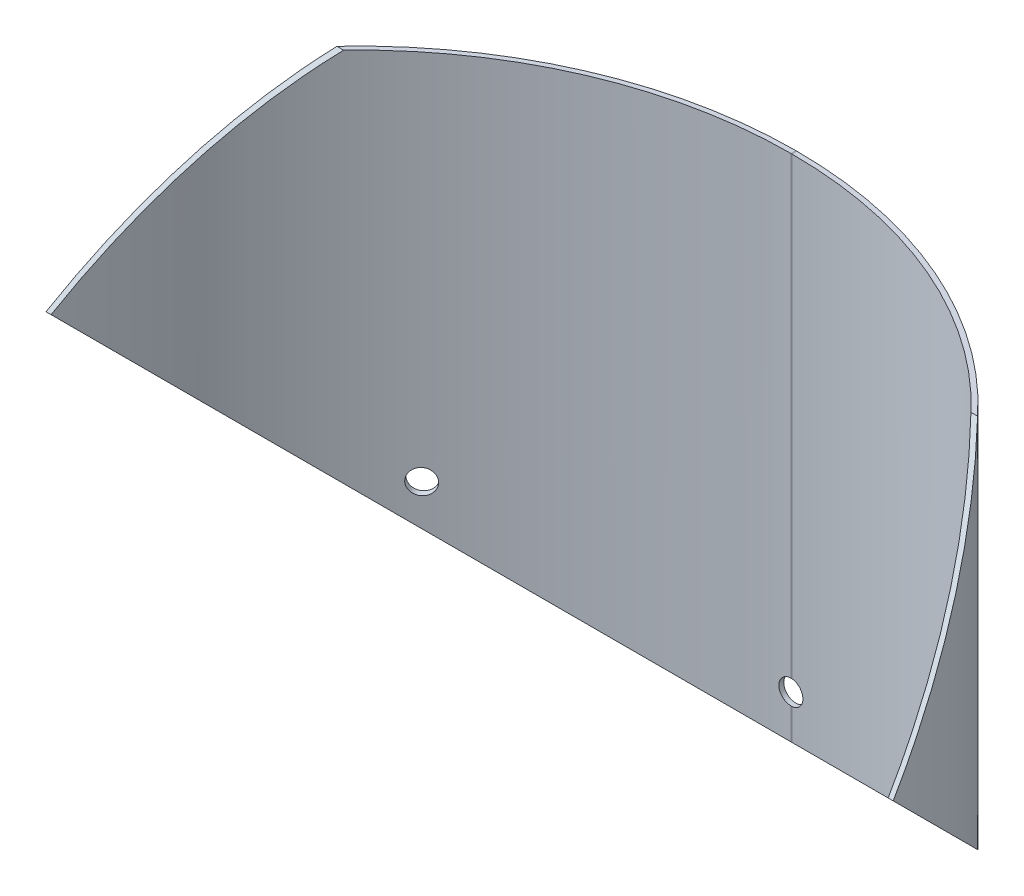
from build123d import *

# Parameters (mm, degrees)
SKETCH1_W                       = 0.254
SKETCH1_H                       = 152.4
BASE_FLANGE1_DEPTH              = 1.29032
EDGE_FLANGE1_DEPTH              = 152.4
EDGE_FLANGE1_BEND_DEPTH         = 152.4
CUT_EXTRUDE6_DEPTH              = 229.952357039
CUT_EXTRUDE6_DEPTH_BACK         = 229.952357039
SKETCH15_R                      = 3.175
CUT_EXTRUDE7_DEPTH              = 208.900927137
CIRPATTERN2_COUNT               = 2
CIRPATTERN2_ANGLE               = 52
CIRPATTERN2_THE_OTHER_WAY_COUNT = 2
CIRPATTERN2_THE_OTHER_WAY_ANGLE = 52


# Sheet-metal steps are written as plain solids
with BuildPart() as part:
    # Sketch1 → Base-Flange1 (new body)
    with BuildSketch(Plane.XY):
        with Locations((0, 76.2)):
            Rectangle(SKETCH1_W, SKETCH1_H)
    extrude(amount=-BASE_FLANGE1_DEPTH)

    # Edge-Flange1 section (across the edge) → Edge-Flange1 (add)
    with BuildSketch(Plane(origin=(114.427, 0, 0), x_dir=(-1, 0, 0), z_dir=(0, 1, 0))):
        with BuildLine():
            Line((-1.29032, 114.3), (-1.29032, 125.70968))
            Line((-1.29032, 125.70968), (0, 125.70968))
            Line((0, 125.70968), (0, 114.3))
            ThreePointArc((0, 114.3), (33.47769491, 33.47769491), (114.3, 0))
            Line((114.3, 0), (114.3, -1.29032))
            ThreePointArc((114.3, -1.29032), (32.565300888, 32.565300888), (-1.29032, 114.3))
        make_face()
    extrude(amount=EDGE_FLANGE1_DEPTH)

    # Edge-Flange1 section 2 (across the edge) → Edge-Flange1 bend (add)
    with BuildSketch(Plane(origin=(-114.427, 152.4, 0), x_dir=(1, 0, 0), z_dir=(0, -1, 0))):
        with BuildLine():
            Line((-1.29032, 114.3), (-1.29032, 125.70968))
            Line((-1.29032, 125.70968), (0, 125.70968))
            Line((0, 125.70968), (0, 114.3))
            ThreePointArc((0, 114.3), (33.47769491, 33.47769491), (114.3, 0))
            Line((114.3, 0), (114.3, -1.29032))
            ThreePointArc((114.3, -1.29032), (32.565300888, 32.565300888), (-1.29032, 114.3))
        make_face()
    extrude(amount=EDGE_FLANGE1_BEND_DEPTH)

    # Sketch14 → Cut-Extrude6 (cut, two sides: drawn at the far end of the back side and taken through both)
    with BuildSketch(Plane(origin=(0, 0, 0), x_dir=(0, 0, -1), z_dir=(1, 0, 0)).offset(-CUT_EXTRUDE6_DEPTH_BACK)):
        Polygon((-85.086344518, 102.789769459), (40.691860392, -22.988435452), (-72.437884386, -136.118180231), (-256.114134731, 47.558070115), (-142.984389953, 160.687814893), (-68.759425458, 243.273840802), (-6.680849316, 181.19526466), align=None)
    extrude(amount=CUT_EXTRUDE6_DEPTH + CUT_EXTRUDE6_DEPTH_BACK, mode=Mode.SUBTRACT)

    # Sketch15 → Cut-Extrude7 (cut, symmetric)
    with BuildSketch(Plane(origin=(0, 0, -1.29032), x_dir=(-1, 0, 0), z_dir=(0, 0, -1))):
        with Locations(Location((0.127, 29.11310494, 0), (0, 0, 90))):
            Circle(SKETCH15_R)
    cut_extrude7 = extrude(amount=CUT_EXTRUDE7_DEPTH, both=True, mode=Mode.SUBTRACT)

    # CirPattern2: Cut-Extrude7 ×2 about axis
    cirpattern2_axis = Axis((0, 79.569647195, 79.569647195), (0, 0.707106781186544, -0.7071067811865511))
    for i in range(1, CIRPATTERN2_COUNT):
        add(cut_extrude7.rotate(cirpattern2_axis, i * CIRPATTERN2_ANGLE / (CIRPATTERN2_COUNT - 1)), mode=Mode.SUBTRACT)

    # CirPattern2 the other way: Cut-Extrude7 ×2 about axis
    cirpattern2_the_other_way_axis = Axis((0, 79.569647195, 79.569647195), (0, -0.707106781186544, 0.7071067811865511))
    for i in range(1, CIRPATTERN2_THE_OTHER_WAY_COUNT):
        add(cut_extrude7.rotate(cirpattern2_the_other_way_axis, i * CIRPATTERN2_THE_OTHER_WAY_ANGLE / (CIRPATTERN2_THE_OTHER_WAY_COUNT - 1)), mode=Mode.SUBTRACT)


solid = part.part
